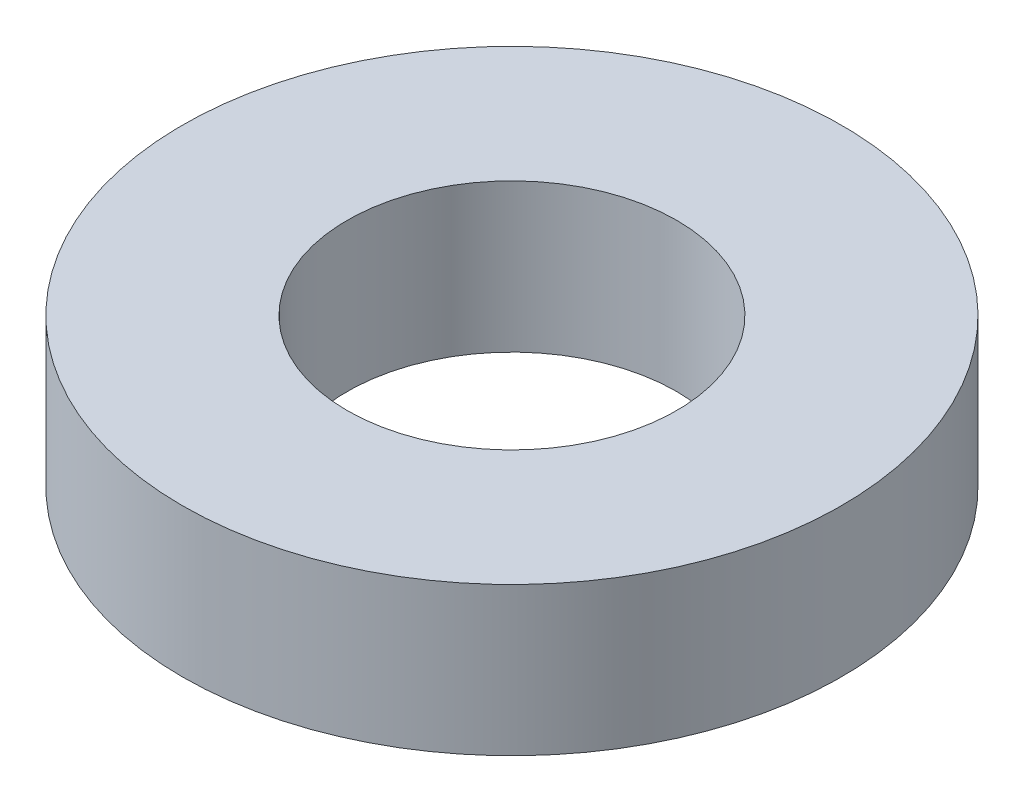
from build123d import *

# Parameters (mm, degrees)
SKETCH1_R           = 20
BOSS_EXTRUDE1_DEPTH = 9
SKETCH2_R           = 10
CUT_EXTRUDE1_DEPTH  = 30.681644159


with BuildPart() as part:
    # Sketch1 → Boss-Extrude1 (new body)
    with BuildSketch(Plane(origin=(0, 0, 0), x_dir=(1, 0, 0), z_dir=(0, 1, 0))):
        Circle(SKETCH1_R)
    extrude(amount=BOSS_EXTRUDE1_DEPTH)

    # Sketch2 → Cut-Extrude1 (cut, through all)
    with BuildSketch(Plane(origin=(0, 0, 0), x_dir=(1, 0, 0), z_dir=(0, 1, 0))):
        Circle(SKETCH2_R)
    extrude(amount=CUT_EXTRUDE1_DEPTH, mode=Mode.SUBTRACT)


solid = part.part
